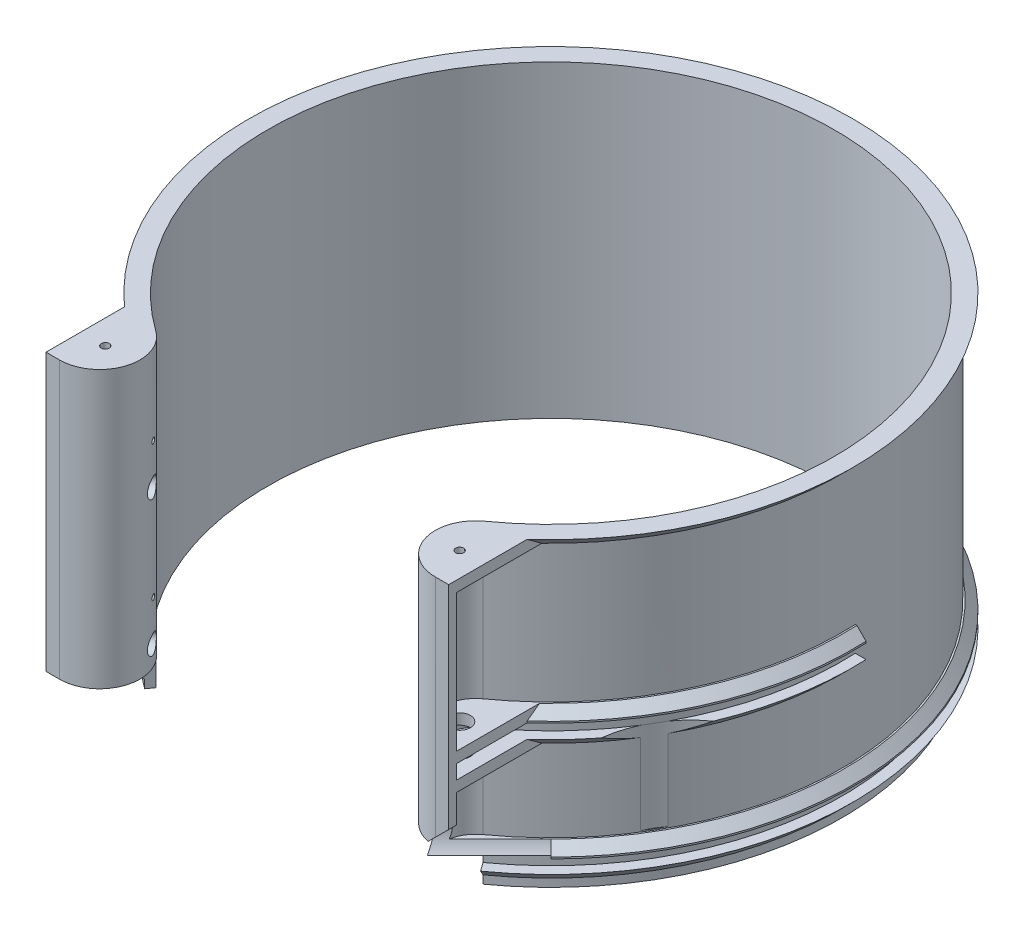
from build123d import *

# Parameters (mm, degrees)
T_LE_START                   = 10
T_LE_PLI_E_BALAY_E3_DEPTH    = 115
T_LE_PLI_E_BALAY_E6_DEPTH    = 115
BOSS_EXTRU_1_DEPTH           = 4
BOSS_EXTRU_2_START           = -9
BOSS_EXTRU_2_DEPTH           = 4
BOSS_EXTRU_4_START           = 99
BOSS_EXTRU_4_DEPTH           = 4
BOSS_EXTRU_5_DEPTH           = 4
BOSS_EXTRU_6_START           = -9.3
BOSS_EXTRU_6_DEPTH           = 4
ESQUISSE31_R                 = 38.00000000003705
ENL_V_MAT_EXTRU_5_DEPTH      = 34
ENL_V_START                  = -12
ENL_V_MAT_EXTRU_2_DEPTH      = 12
ENL_V_MAT_EXTRU_4_DEPTH      = 203.65484497971678
CHANFREIN1_SIZE              = 8
CHANFREIN2_SIZE              = 4
CHANFREIN3_SIZE              = 3.4
ENL_V_MAT_EXTRU_6_REACH      = 283.737
ENL_V_MAT_EXTRU_6_END_RADIUS = 15.000000000000016
ESQUISSE32_R                 = 0.9999999999999983
ESQUISSE32_R_2               = 3.4999999999999996
ESQUISSE32_R_3               = 3.500000000000001
ESQUISSE33_R                 = 1.4999999999999973
ENL_V_MAT_EXTRU_7_DEPTH      = 203.65484515271058
ESQUISSE34_R                 = 4.000000000000007
ENL_V_MAT_EXTRU_8_DEPTH      = 171.35265257362215


# Read off the part's stored shape, not the designer's step: Tôle pliée balayée3, Tôle pliée balayée6
with BuildPart() as part:
    # Tôle pliée balayée3 outline → Tôle pliée balayée3 (new body)
    with BuildSketch(Plane(origin=(0, 0, 0), x_dir=(1, 0, 0), z_dir=(0, 1, 0)).offset(T_LE_START)):
        with BuildLine():
            ThreePointArc((63.029045643, -88.315284098), (103.330678708, 33.09109907), (0, 108.5))
            Line((0, 108.5), (0, 105.5))
            ThreePointArc((0, 105.5), (100.473609251, 32.176137806), (61.286307054, -85.873386842))
            ThreePointArc((61.286307054, -85.873386842), (55.714652713, -102.657679446), (70, -113.082873123))
            Line((70, -113.082873123), (75, -113.082873123))
            Line((75, -113.082873123), (75, -110.082873123))
            Line((75, -110.082873123), (70, -110.082873123))
            ThreePointArc((70, -110.082873123), (58.571722171, -101.742718181), (63.029045643, -88.315284098))
        make_face()
    extrude(amount=T_LE_PLI_E_BALAY_E3_DEPTH)



with BuildPart() as body_2:
    # Tôle pliée balayée6 outline → Tôle pliée balayée6 (new body)
    with BuildSketch(Plane(origin=(0, 0, 0), x_dir=(1, 0, 0), z_dir=(0, 1, 0)).offset(T_LE_START)):
        with BuildLine():
            Line((-70, -110.082873123), (-75, -110.082873123))
            Line((-75, -110.082873123), (-75, -113.082873123))
            Line((-75, -113.082873123), (-70, -113.082873123))
            ThreePointArc((-70, -113.082873123), (-55.714652713, -102.657679446), (-61.286307054, -85.873386842))
            ThreePointArc((-61.286307054, -85.873386842), (-100.473609251, 32.176137806), (0, 105.5))
            Line((0, 105.5), (0, 108.5))
            ThreePointArc((0, 108.5), (-103.330678708, 33.09109907), (-63.029045643, -88.315284098))
            ThreePointArc((-63.029045643, -88.315284098), (-58.571722171, -101.742718181), (-70, -110.082873123))
        make_face()
    extrude(amount=T_LE_PLI_E_BALAY_E6_DEPTH)


with BuildPart() as part_1:
    add(part.part)

    add(body_2.part)  # Boss.-Extru.1 merges body 2
    # Esquisse27 → Boss.-Extru.1 (add)
    with BuildSketch(Plane(origin=(0, 22.000000000000018, 0), x_dir=(1, 0, 0), z_dir=(0, 1, 0))):
        with BuildLine():
            Line((-70.00000000000004, -110.0828731226813), (-75.00000000000064, -110.08287312268126))
            Line((-75.00000000000064, -110.08287312268126), (-75.00000000000064, -83.85254915624154))
            ThreePointArc((-75.00000000000064, -83.85254915624154), (-105.09439038330535, 40.14248509947301), (3.444e-14, 112.49999999999999))
            ThreePointArc((3.444e-14, 112.49999999999999), (105.09439038330547, 40.14248509947265), (75.00000000000007, -83.85254915624202))
            Line((75.00000000000007, -83.85254915624202), (75.00000000000007, -110.08287312268126))
            Line((75.00000000000007, -110.08287312268126), (70.00000000000006, -110.08287312268126))
            ThreePointArc((70.00000000000006, -110.08287312268126), (58.57172217051094, -101.74271818115135), (63.029045643153566, -88.31528409801591))
            ThreePointArc((63.029045643153566, -88.31528409801591), (103.33067870829728, 33.09109907033365), (5.9e-16, 108.49999999999999))
            ThreePointArc((5.9e-16, 108.49999999999999), (-103.33067870829728, 33.091099070333684), (-63.029045643153566, -88.31528409801591))
            ThreePointArc((-63.029045643153566, -88.31528409801591), (-58.571722170510924, -101.74271818115137), (-70.00000000000004, -110.0828731226813))
        make_face()
    extrude(amount=BOSS_EXTRU_1_DEPTH)

    # Esquisse27<2> → Boss.-Extru.2 (add)
    with BuildSketch(Plane(origin=(0, 22.000000000000018, 0), x_dir=(1, 0, 0), z_dir=(0, 1, 0)).offset(BOSS_EXTRU_2_START)):
        with BuildLine():
            Line((-70.00000000000004, -110.0828731226813), (-75.00000000000064, -110.08287312268126))
            Line((-75.00000000000064, -110.08287312268126), (-75.00000000000064, -83.85254915624154))
            ThreePointArc((-75.00000000000064, -83.85254915624154), (-105.09439038330535, 40.14248509947301), (3.444e-14, 112.49999999999999))
            ThreePointArc((3.444e-14, 112.49999999999999), (105.09439038330547, 40.14248509947265), (75.00000000000007, -83.85254915624202))
            Line((75.00000000000007, -83.85254915624202), (75.00000000000007, -110.08287312268126))
            Line((75.00000000000007, -110.08287312268126), (70.00000000000006, -110.08287312268126))
            ThreePointArc((70.00000000000006, -110.08287312268126), (58.57172217051094, -101.74271818115135), (63.029045643153566, -88.31528409801591))
            ThreePointArc((63.029045643153566, -88.31528409801591), (103.33067870829728, 33.09109907033365), (5.9e-16, 108.49999999999999))
            ThreePointArc((5.9e-16, 108.49999999999999), (-103.33067870829728, 33.091099070333684), (-63.029045643153566, -88.31528409801591))
            ThreePointArc((-63.029045643153566, -88.31528409801591), (-58.571722170510924, -101.74271818115137), (-70.00000000000004, -110.0828731226813))
        make_face()
    extrude(amount=BOSS_EXTRU_2_DEPTH)

    # Esquisse27<4> → Boss.-Extru.4 (add)
    with BuildSketch(Plane(origin=(0, 22.000000000000018, 0), x_dir=(1, 0, 0), z_dir=(0, 1, 0)).offset(BOSS_EXTRU_4_START)):
        with BuildLine():
            Line((-70.00000000000004, -110.0828731226813), (-75.00000000000064, -110.08287312268126))
            Line((-75.00000000000064, -110.08287312268126), (-75.00000000000064, -83.85254915624154))
            ThreePointArc((-75.00000000000064, -83.85254915624154), (-105.09439038330535, 40.14248509947301), (3.444e-14, 112.49999999999999))
            ThreePointArc((3.444e-14, 112.49999999999999), (105.09439038330547, 40.14248509947265), (75.00000000000007, -83.85254915624202))
            Line((75.00000000000007, -83.85254915624202), (75.00000000000007, -110.08287312268126))
            Line((75.00000000000007, -110.08287312268126), (70.00000000000006, -110.08287312268126))
            ThreePointArc((70.00000000000006, -110.08287312268126), (58.57172217051094, -101.74271818115135), (63.029045643153566, -88.31528409801591))
            ThreePointArc((63.029045643153566, -88.31528409801591), (103.33067870829728, 33.09109907033365), (5.9e-16, 108.49999999999999))
            ThreePointArc((5.9e-16, 108.49999999999999), (-103.33067870829728, 33.091099070333684), (-63.029045643153566, -88.31528409801591))
            ThreePointArc((-63.029045643153566, -88.31528409801591), (-58.571722170510924, -101.74271818115137), (-70.00000000000004, -110.0828731226813))
        make_face()
    extrude(amount=BOSS_EXTRU_4_DEPTH)

    # Esquisse30 → Boss.-Extru.5 (add)
    with BuildSketch(Plane(origin=(0, 65.80000000000094, 0), x_dir=(1, 0, 0), z_dir=(0, 1, 0))):
        with BuildLine():
            Line((112.38883396494509, 5.0000000000003375), (108.3847313970007, 5.000000000000365))
            ThreePointArc((108.3847313970007, 5.000000000000365), (97.58384241956402, -47.430409007657644), (63.029045643153594, -88.31528409801588))
            ThreePointArc((63.029045643153594, -88.31528409801588), (58.571722170510924, -101.74271818115133), (70.00000000000004, -110.08287312268126))
            Line((70.00000000000004, -110.08287312268126), (75.00000000000007, -110.08287312268126))
            Line((75.00000000000007, -110.08287312268126), (75.00000000000009, -83.85254915624203))
            ThreePointArc((75.00000000000009, -83.85254915624203), (103.69347928667484, -43.63384412842782), (112.38883396494509, 5.0000000000003375))
        make_face()
    extrude(amount=BOSS_EXTRU_5_DEPTH)

    # Esquisse30<2> → Boss.-Extru.6 (add)
    with BuildSketch(Plane(origin=(0, 65.80000000000094, 0), x_dir=(1, 0, 0), z_dir=(0, 1, 0)).offset(BOSS_EXTRU_6_START)):
        with BuildLine():
            ThreePointArc((75.00000000000009, -83.85254915624205), (103.69347928667489, -43.63384412842781), (112.38883396494512, 5.00000000000034))
            Line((112.38883396494509, 5.0000000000003375), (108.3847313970007, 5.000000000000365))
            ThreePointArc((108.38473139700066, 5.000000000000341), (97.583842419564, -47.43040900765764), (63.02904564315359, -88.31528409801587))
            ThreePointArc((63.029045643153594, -88.31528409801588), (58.57172217051092, -101.74271818115132), (70.00000000000004, -110.08287312268125))
            Line((70.00000000000004, -110.08287312268126), (75.00000000000007, -110.08287312268126))
            Line((75.00000000000007, -110.08287312268126), (75.00000000000009, -83.85254915624203))
        make_face()
    extrude(amount=BOSS_EXTRU_6_DEPTH)

    # Esquisse31 → Enlèv. mat.-Extru.5 (cut)
    with BuildSketch(Plane(origin=(0, 60.500000000000945, 0), x_dir=(1, 0, 0), z_dir=(0, 1, 0))):
        with Locations((126.10000000000012, -74.08287312268061)):
            Circle(ESQUISSE31_R)
    extrude(amount=-ENL_V_MAT_EXTRU_5_DEPTH, mode=Mode.SUBTRACT)

    # Esquisse21 → Enlèv. mat.-Extru.2 (cut)
    with BuildSketch(Plane.XZ.offset(-10).offset(ENL_V_START)):
        with BuildLine():
            Line((-61.28630705394195, 85.87338684184958), (-65.35269709543574, 91.5711471062377))
            ThreePointArc((-65.35269709543574, 91.5711471062377), (-70.28238815001416, 87.84438465793217), (-75.00000000000064, 83.85254915624154))
            Line((-75.00000000000064, 83.85254915624154), (-75.00000000000065, 113.08287312268126))
            Line((-75.00000000000065, 113.08287312268126), (-70.00000000000004, 113.0828731226813))
            ThreePointArc((-70.00000000000004, 113.0828731226813), (-55.71465271313865, 102.65767944576889), (-61.28630705394195, 85.87338684184958))
        make_face()
        with BuildLine():
            Line((75.00000000000063, 113.08287312268124), (75.00000000000064, 83.85254915624151))
            ThreePointArc((75.00000000000064, 83.85254915624151), (70.28238815001416, 87.84438465793214), (65.35269709543574, 91.57114710623767))
            Line((65.35269709543574, 91.57114710623767), (61.28630705394193, 85.87338684184955))
            ThreePointArc((61.28630705394193, 85.87338684184955), (55.71465271313865, 102.65767944576888), (70.00000000000004, 113.08287312268128))
            Line((70.00000000000004, 113.08287312268128), (75.00000000000063, 113.08287312268124))
        make_face()
    extrude(amount=ENL_V_MAT_EXTRU_2_DEPTH, mode=Mode.SUBTRACT)

    # Esquisse26 → Enlèv. mat.-Extru.4 (cut, through all)
    with BuildSketch(Plane(origin=(0, 0, 0), x_dir=(0, -1, 0), z_dir=(0.7071067811865464, 0, -0.7071067811865488))):
        with BuildLine():
            Line((-38.000000000000014, -173.5875978985506), (-22.000000000000014, -173.5875978985506))
            Line((-22.000000000000014, -173.5875978985506), (-22.000000000000014, -110.81142245955047))
            ThreePointArc((-22.000000000000014, -110.81142245955047), (-30.000000000000014, -108.5), (-38.000000000000014, -110.81142245955047))
            Line((-38.000000000000014, -110.81142245955047), (-38.000000000000014, -173.5875978985506))
        make_face()
    extrude(amount=-ENL_V_MAT_EXTRU_4_DEPTH, mode=Mode.SUBTRACT)

    # Chanfrein1
    chanfrein1_edges = [part_1.edges().sort_by_distance(p)[0] for p in [
        (75, 38.000000000000014, 111.582873123),
    ]]
    chamfer(chanfrein1_edges, length=CHANFREIN1_SIZE)

    # Chanfrein2
    chanfrein2_edges = [part_1.edges().sort_by_distance(p)[0] for p in [
        (3.4817e-13, 121.00000000000001, -112.5),
        (110.77691614603881, 56.50000000000094, 19.614404124864386),
        (81.98978281662204, 56.50000000000094, 77.03197721520041),
        (1.64135e-12, 13.000000000000018, -112.5000000000024),
    ]]
    chamfer(chanfrein2_edges, length=CHANFREIN2_SIZE - 0.0001)  # a hair under: the kernel refuses the full size

    # Chanfrein3
    chanfrein3_edges = [part_1.edges().sort_by_distance(p)[0] for p in [
        (103.69347928667484, 69.80000000000094, 43.633844128427825),
        (-3.131061666657576, 26.000000000000018, -112.45642023841762),
    ]]
    chamfer(chanfrein3_edges, length=CHANFREIN3_SIZE)

    # Enlèv. mat.-Extru.6: up to this cylinder (the profile starts inside it)
    enl_v_mat_extru_6_end = Plane(origin=(-70.00000000000004, 62.25, 98.08287312268129), z_dir=(0, -1, 0)) * Cylinder(ENL_V_MAT_EXTRU_6_END_RADIUS, 663.974, mode=Mode.PRIVATE)
    # Esquisse32 → Enlèv. mat.-Extru.6 (cut, up to the surface)
    with BuildSketch(Plane(origin=(-87.47087345736037, 9.47e-15, 41.65016536989822), x_dir=(0.4299114386441376, 0, 0.902871062180491), z_dir=(-0.902871062180491, 0, 0.4299114386441376)), mode=Mode.PRIVATE) as enl_v_mat_extru_6_sk1:
        with Locations((58.46238713290111, 95)):
            Circle(ESQUISSE32_R)
    enl_v_mat_extru_6_tool1 = extrude(enl_v_mat_extru_6_sk1.sketch, amount=-ENL_V_MAT_EXTRU_6_REACH, mode=Mode.PRIVATE) & enl_v_mat_extru_6_end
    add(enl_v_mat_extru_6_tool1.solids().sort_by_distance((-62.337224, 95, 94.434163))[0], mode=Mode.SUBTRACT)
    # Esquisse32 → Enlèv. mat.-Extru.6 (cut, up to the surface)
    with BuildSketch(Plane(origin=(-87.47087345736037, 9.47e-15, 41.65016536989822), x_dir=(0.4299114386441376, 0, 0.902871062180491), z_dir=(-0.902871062180491, 0, 0.4299114386441376)), mode=Mode.PRIVATE) as enl_v_mat_extru_6_sk2:
        with Locations((58.462387132901135, 44.5)):
            Circle(ESQUISSE32_R)
    enl_v_mat_extru_6_tool2 = extrude(enl_v_mat_extru_6_sk2.sketch, amount=-ENL_V_MAT_EXTRU_6_REACH, mode=Mode.PRIVATE) & enl_v_mat_extru_6_end
    add(enl_v_mat_extru_6_tool2.solids().sort_by_distance((-62.337224, 44.5, 94.434163))[0], mode=Mode.SUBTRACT)
    # Esquisse32 → Enlèv. mat.-Extru.6 (cut, up to the surface)
    with BuildSketch(Plane(origin=(-87.47087345736037, 9.47e-15, 41.65016536989822), x_dir=(0.4299114386441376, 0, 0.902871062180491), z_dir=(-0.902871062180491, 0, 0.4299114386441376)), mode=Mode.PRIVATE) as enl_v_mat_extru_6_sk3:
        with Locations((58.462387132901135, 29.499999999999996)):
            Circle(ESQUISSE32_R_2)
    enl_v_mat_extru_6_tool3 = extrude(enl_v_mat_extru_6_sk3.sketch, amount=-ENL_V_MAT_EXTRU_6_REACH, mode=Mode.PRIVATE) & enl_v_mat_extru_6_end
    add(enl_v_mat_extru_6_tool3.solids().sort_by_distance((-62.337224, 29.5, 94.434163))[0], mode=Mode.SUBTRACT)
    # Esquisse32 → Enlèv. mat.-Extru.6 (cut, up to the surface)
    with BuildSketch(Plane(origin=(-87.47087345736037, 9.47e-15, 41.65016536989822), x_dir=(0.4299114386441376, 0, 0.902871062180491), z_dir=(-0.902871062180491, 0, 0.4299114386441376)), mode=Mode.PRIVATE) as enl_v_mat_extru_6_sk4:
        with Locations((58.46238713290111, 80)):
            Circle(ESQUISSE32_R_3)
    enl_v_mat_extru_6_tool4 = extrude(enl_v_mat_extru_6_sk4.sketch, amount=-ENL_V_MAT_EXTRU_6_REACH, mode=Mode.PRIVATE) & enl_v_mat_extru_6_end
    add(enl_v_mat_extru_6_tool4.solids().sort_by_distance((-62.337224, 80, 94.434163))[0], mode=Mode.SUBTRACT)

    # Esquisse33 → Enlèv. mat.-Extru.7 (cut, through all)
    with BuildSketch(Plane(origin=(0, 0, 0), x_dir=(1, 0, 0), z_dir=(0, 1, 0))):
        with Locations(Location((-66.00000000005294, -99.9999999999795, 0), (0, 0, 270))):
            Circle(ESQUISSE33_R)
        with Locations(Location((66.00000000005197, -99.99999999999093, 0), (0, 0, 270))):
            Circle(ESQUISSE33_R)
    extrude(amount=ENL_V_MAT_EXTRU_7_DEPTH, mode=Mode.SUBTRACT)

    # Esquisse34 → Enlèv. mat.-Extru.8 (cut, through all)
    with BuildSketch(Plane(origin=(0, 69.80000000000095, 0), x_dir=(1, 0, 0), z_dir=(0, 1, 0))):
        with Locations(Location((66.00000000005197, -99.99999999999093, 0), (0, 0, 270))):
            Circle(ESQUISSE34_R)
    extrude(amount=-ENL_V_MAT_EXTRU_8_DEPTH, mode=Mode.SUBTRACT)


solid = part_1.part
